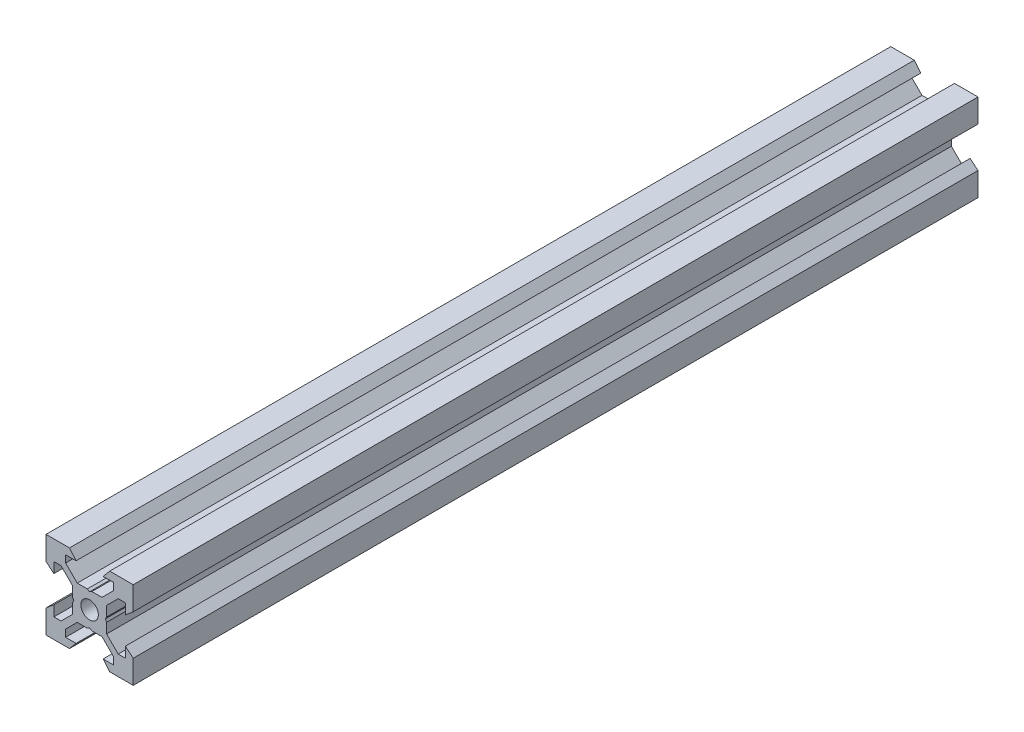
from build123d import *

# Parameters (mm, degrees)
SKETCH1_R           = 2
BOSS_EXTRUDE1_DEPTH = 96.87


with BuildPart() as part:
    # Sketch1 → Boss-Extrude1 (new, symmetric)
    with BuildSketch(Plane.XY):
        Polygon((10, 4.610379336), (10, 10), (4.610379336, 10), (3.1, 8.2), (5.5, 8.2), (5.5, 6.560660172), (2.839339828, 3.9), (0.519615242, 3.9), (0, 3.6), (-0.519615242, 3.9), (-2.839339828, 3.9), (-5.5, 6.560660172), (-5.5, 8.2), (-3.1, 8.2), (-4.610379336, 10), (-10, 10), (-10, 4.610379336), (-8.2, 3.1), (-8.2, 5.5), (-6.560660172, 5.5), (-3.9, 2.839339828), (-3.9, 0.519615242), (-3.6, 0), (-3.9, -0.519615242), (-3.9, -2.839339828), (-6.560660172, -5.5), (-8.2, -5.5), (-8.2, -3.1), (-10, -4.610379336), (-10, -10), (-4.610379336, -10), (-3.1, -8.2), (-5.5, -8.2), (-5.5, -6.560660172), (-2.839339828, -3.9), (-0.519615242, -3.9), (0, -3.6), (0.519615242, -3.9), (2.839339828, -3.9), (5.5, -6.560660172), (5.5, -8.2), (3.1, -8.2), (4.610379336, -10), (10, -10), (10, -4.610379336), (8.2, -3.1), (8.2, -5.5), (6.560660172, -5.5), (3.9, -2.839339828), (3.9, -0.519615242), (3.6, 0), (3.9, 0.519615242), (3.9, 2.839339828), (6.560660172, 5.5), (8.2, 5.5), (8.2, 3.1), align=None)
        Circle(SKETCH1_R, mode=Mode.SUBTRACT)
    extrude(amount=BOSS_EXTRUDE1_DEPTH, both=True)


solid = part.part
